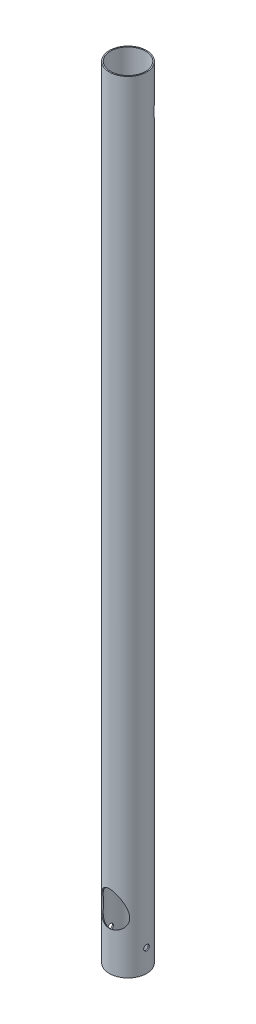
from build123d import *

# Parameters (mm, degrees)
EXTRUDE_1_OUTLINE_R      = 66.5
EXTRUDE_1_OUTLINE_R_2    = 62.5
EXTRUDE_1_DEPTH          = 2780
CUT_EXTRUDE_3_DEPTH      = 2782.590282554
CUT_EXTRUDE_3_DEPTH_BACK = 2782.590282554
SKETCH_6_R               = 10
SKETCH_7_R               = 50
CUT_EXTRUDE_4_DEPTH      = 200
SKETCH_10_R              = 55
CUT_EXTRUDE_5_DEPTH      = 2782.590282659
SKETCH_13_R              = 52.5
CUT_EXTRUDE_8_DEPTH      = 200


# Read off the part's stored shape, not the designer's step: Вытянуть-Тонкостенный1
with BuildPart() as part:
    # Вытянуть-Тонкостенный1 outline → Вытянуть-Тонкостенный1 (new body)
    with BuildSketch(Plane(origin=(0, 0, 0), x_dir=(1, 0, 0), z_dir=(0, 1, 0))):
        Circle(EXTRUDE_1_OUTLINE_R)
        Circle(EXTRUDE_1_OUTLINE_R_2, mode=Mode.SUBTRACT)
    extrude(amount=EXTRUDE_1_DEPTH)

    # Эскиз6 → Вырез-Вытянуть3 (cut, two sides: drawn at the far end of the back side and taken through both)
    with BuildSketch(Plane(origin=(0, 0, 0), x_dir=(0, 0, -1), z_dir=(1, 0, 0)).offset(-CUT_EXTRUDE_3_DEPTH_BACK)):
        with Locations((0, 80)):
            Circle(SKETCH_6_R)
    extrude(amount=CUT_EXTRUDE_3_DEPTH + CUT_EXTRUDE_3_DEPTH_BACK, mode=Mode.SUBTRACT)

    # Эскиз7 → Вырез-Вытянуть4 (cut)
    with BuildSketch(Plane(origin=(0, 176.689515805, 252.338779809), x_dir=(1, 0, 0), z_dir=(0, -0.5735764363510416, -0.8191520442889949))):
        with Locations(Location((0, -126.118813858, 0), (0, 0, 90))):
            Circle(SKETCH_7_R)
    extrude(amount=CUT_EXTRUDE_4_DEPTH, mode=Mode.SUBTRACT)

    # Эскиз10 → Вырез-Вытянуть5 (cut, through all)
    with BuildSketch(Plane.XY):
        with Locations(Location((0, 2630, 0), (0, 0, 90))):
            Circle(SKETCH_10_R)
    extrude(amount=-CUT_EXTRUDE_5_DEPTH, mode=Mode.SUBTRACT)

    # Эскиз13 → Вырез-Вытянуть8 (cut)
    with BuildSketch(Plane(origin=(0, 751.957243663, 1073.906238692), x_dir=(1, 0, 0), z_dir=(0, -0.5735764363510416, -0.8191520442889949))):
        with Locations((0, -2186.118813857)):
            Circle(SKETCH_13_R)
    extrude(amount=-CUT_EXTRUDE_8_DEPTH, mode=Mode.SUBTRACT)


solid = part.part
